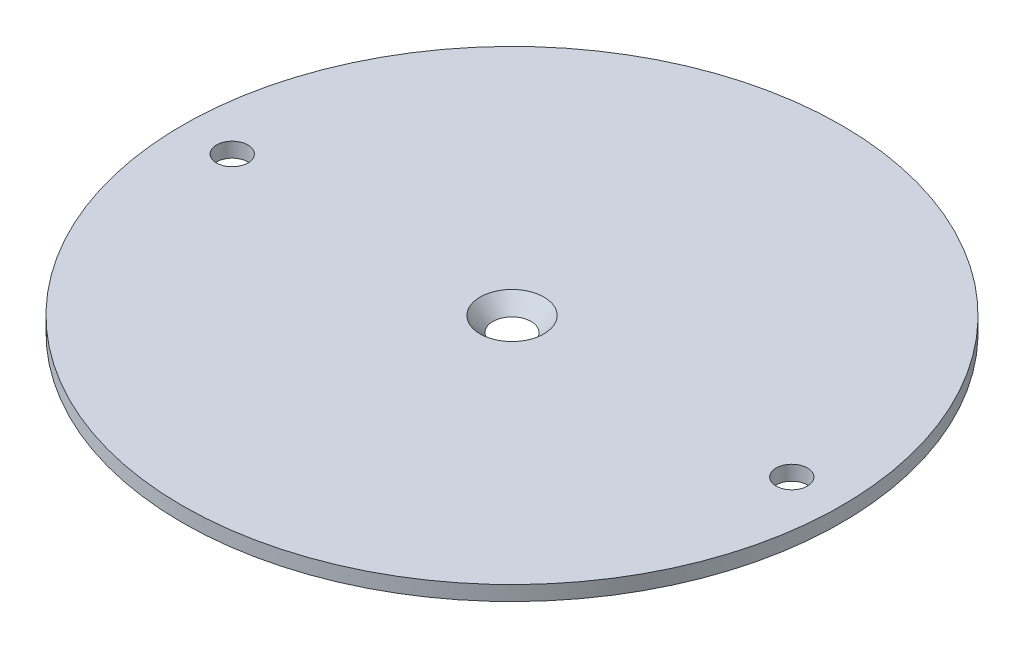
from build123d import *

# Parameters (mm, degrees)
SKETCH2_R               = 71.0565
BOSS_EXTRUDE1_DEPTH     = 3.175
F_1_4_CLEARANCE_HOLE1_D = 6.7564


with BuildPart() as part:
    # Sketch2 → Boss-Extrude1 (new body)
    with BuildSketch(Plane(origin=(0, 0, 0), x_dir=(1, 0, 0), z_dir=(0, 1, 0))):
        Circle(SKETCH2_R)
    extrude(amount=BOSS_EXTRUDE1_DEPTH)

    # 1/4 Clearance Hole1 (through all)
    with Locations(Plane(origin=(0, 3.175, 0), x_dir=(1, 0, 0), z_dir=(0, 1, 0))):
        with Locations((-60.325, 0), (60.325, 0)):
            Hole(F_1_4_CLEARANCE_HOLE1_D / 2)

    # Sketch7 → CSK for 1/4 Flat Head Machine Screw1 (revolve, cut)
    with BuildSketch(Plane(origin=(0, 3.175, 0), x_dir=(0, 0, 1), z_dir=(1, 0, 0))):
        Polygon((0, 0), (0, 3.175), (3.3782, 3.175), (3.3782, 4.032271341), (6.8834, 0), align=None)
    revolve(axis=Axis((0, 9.525, 0), (0, -1, 0)), mode=Mode.SUBTRACT)


solid = part.part
